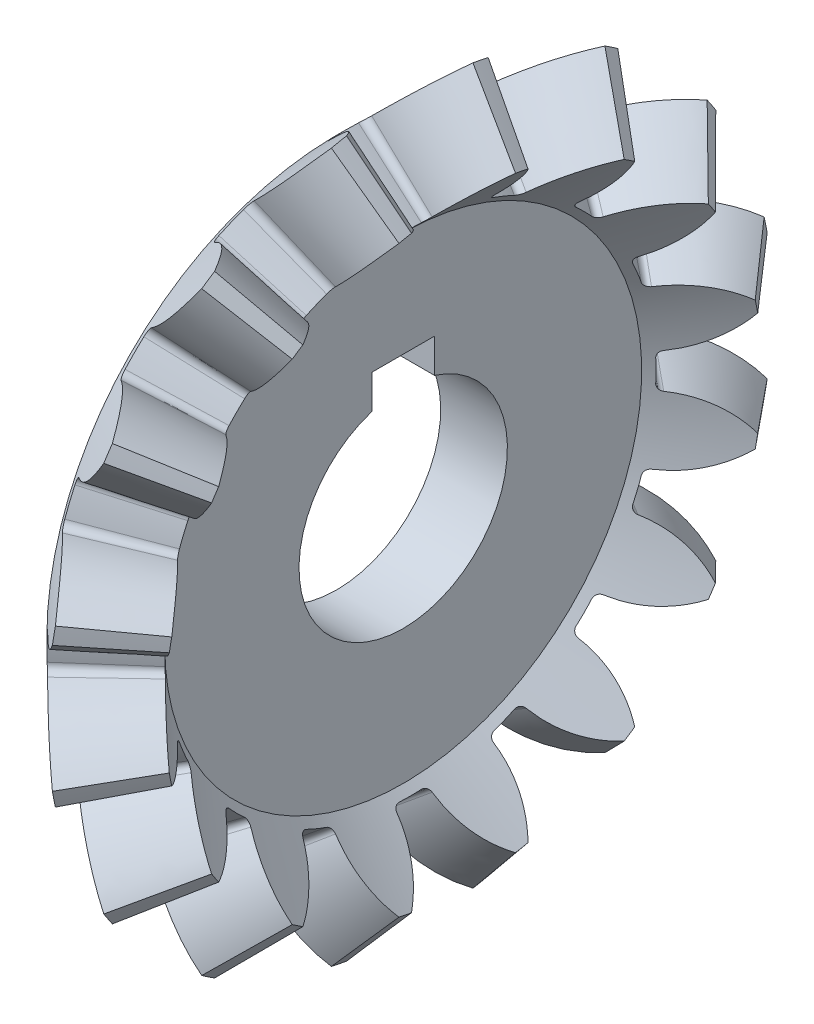
from build123d import *

# Parameters (mm, degrees)
TEETHCUTS_COUNT = 16
TEETHCUTS_ANGLE = 337.5
HUBSKE_R        = 20
HUB_DEPTH       = 0.0001016
BORSKE_R        = 10
BORE_DEPTH      = 36.201148964
KEYSKE_W        = 6
KEYSKE_H        = 12.8
KEYWAY_DEPTH    = 36.201148964


with BuildPart() as part:
    # BasProSke → Base-Revolve (revolve)
    with BuildSketch(Plane(origin=(0, 0, 0), x_dir=(1, 0, 0), z_dir=(0, 1, 0)), mode=Mode.PRIVATE) as base_revolve_sk:
        Polygon((0, 0), (0, 27.79890184), (7.029525295, 34.828427122), (12.186379538, 28.671572868), (6.399510496, 22.884703835), (6.399510496, 0), align=None)
    revolve(base_revolve_sk.sketch.rotate(Axis((-10, 0, 0), (1, 0, 0)), 180), axis=Axis((-10, 0, 0), (1, 0, 0)))

    # ToothCut: read off the stored shape, not the designer's step
    # ToothCut: loft between two sections, ruled curve by curve
    toothcut_from = [
        Edge.make_bspline([(36.206891829, 0.005793661, -0.009703418), (36.202752871, 0.001654704, -0.014645972), (36.197364322, -0.003733846, -0.013859942), (36.194025889, -0.007072278, -0.007826658)], [0, 0, 0, 0, 1, 1, 1, 1], 3, [1, 0.79588138, 0.79588138, 1]),
        Edge.make_bspline([(36.194025889, -0.007072278, 0.007826658), (36.197364322, -0.003733846, 0.013859942), (36.202752871, 0.001654704, 0.014645972), (36.206891829, 0.005793661, 0.009703418)], [0, 0, 0, 0, 1, 1, 1, 1], 3, [1, 0.79588138, 0.79588138, 1]),
        Edge.make_bspline([(36.194025889, -0.007072278, -0.007826658), (36.193482763, -0.007615404, -0.006845109), (36.193046909, -0.008051258, -0.005761841), (36.192727687, -0.008370481, -0.004600116)], [0, 0, 0, 0, 1, 1, 1, 1], 3, [1, 0.99284125, 0.99284125, 1]),
        Edge.make_bspline([(36.192727687, -0.008370481, 0.004600116), (36.193046909, -0.008051258, 0.005761841), (36.193482763, -0.007615404, 0.006845109), (36.194025889, -0.007072278, 0.007826658)], [0, 0, 0, 0, 1, 1, 1, 1], 3, [1, 0.99284125, 0.99284125, 1]),
        Edge.make_bspline([(36.192727687, -0.008370481, -0.004600116), (36.191904976, -0.009193191, -0.001606079), (36.191904976, -0.009193191, 0.001606079), (36.192727687, -0.008370481, 0.004600116)], [0, 0, 0, 0, 1, 1, 1, 1], 3, [1, 0.954730001, 0.954730001, 1]),
        Edge.make_line((36.206891829, 0.005793661, 0.009703418), (36.206891829, 0.005793661, -0.009703418)),
    ]
    toothcut_to = [
        Edge.make_bspline([(7.109764347, 34.908666175, -6.646451093), (5.632990485, 33.431892315, -4.092410632), (3.594649708, 31.393551541, -2.487674356), (1.281610641, 29.080512478, -2.058086977)], [0, 0, 0, 0, 1, 1, 1, 1], 3, [1, 0.953087886, 0.953087886, 1]),
        Edge.make_bspline([(1.281610641, 29.080512478, 2.058086977), (3.594649708, 31.393551541, 2.487674356), (5.632990485, 33.431892315, 4.092410632), (7.109764347, 34.908666175, 6.646451093)], [0, 0, 0, 0, 1, 1, 1, 1], 3, [1, 0.953087886, 0.953087886, 1]),
        Edge.make_bspline([(1.281610641, 29.080512478, -2.058086977), (0.992514696, 28.791416534, -2.004394858), (0.805416205, 28.604318044, -1.688129016), (0.819073498, 28.617975336, -1.276227656)], [0, 0, 0, 0, 1, 1, 1, 1], 3, [1, 0.824052866, 0.824052866, 1]),
        Edge.make_bspline([(0.819073498, 28.617975336, 1.276227656), (0.805416205, 28.604318044, 1.688129016), (0.992514696, 28.791416534, 2.004394858), (1.281610641, 29.080512478, 2.058086977)], [0, 0, 0, 0, 1, 1, 1, 1], 3, [1, 0.824052866, 0.824052866, 1]),
        Edge.make_bspline([(0.819073498, 28.617975336, -1.276227656), (0.847273507, 28.646175345, -0.425720721), (0.847273507, 28.646175345, 0.425720721), (0.819073498, 28.617975336, 1.276227656)], [0, 0, 0, 0, 1, 1, 1, 1], 3, [1, 0.999268295, 0.999268295, 1]),
        Edge.make_line((7.109764347, 34.908666175, 6.646451093), (7.109764347, 34.908666175, -6.646451093)),
    ]
    toothcut = Solid(Shell([*[Face.make_surface_from_curves(toothcut_from[k], toothcut_to[k]) for k in range(6)], Face(Wire(toothcut_from)), Face(Wire(toothcut_to))]))
    add(toothcut, mode=Mode.SUBTRACT)

    # TeethCuts: ToothCut ×16 about axis
    teethcuts_axis = Axis((-10, 0, 0), (1, 0, 0))
    for i in range(1, TEETHCUTS_COUNT):
        add(toothcut.rotate(teethcuts_axis, i * TEETHCUTS_ANGLE / (TEETHCUTS_COUNT - 1)), mode=Mode.SUBTRACT)

    # HubSke → Hub (add)
    with BuildSketch(Plane.ZY):
        with Locations(Location((0, 0, 0), (0, 0, 180))):
            Circle(HUBSKE_R)
    extrude(amount=HUB_DEPTH)

    # BorSke → Bore (cut, symmetric)
    with BuildSketch(Plane(origin=(0, 0, 0), x_dir=(0, 0, -1), z_dir=(1, 0, 0))):
        with Locations(Location((0, 0, 0), (0, 0, 180))):
            Circle(BORSKE_R)
    extrude(amount=BORE_DEPTH, both=True, mode=Mode.SUBTRACT)

    # KeySke → Keyway (cut, symmetric)
    with BuildSketch(Plane(origin=(0, 0, 0), x_dir=(0, 0, -1), z_dir=(1, 0, 0))):
        with Locations((0, 6.4)):
            Rectangle(KEYSKE_W, KEYSKE_H)
    extrude(amount=KEYWAY_DEPTH, both=True, mode=Mode.SUBTRACT)


solid = part.part
